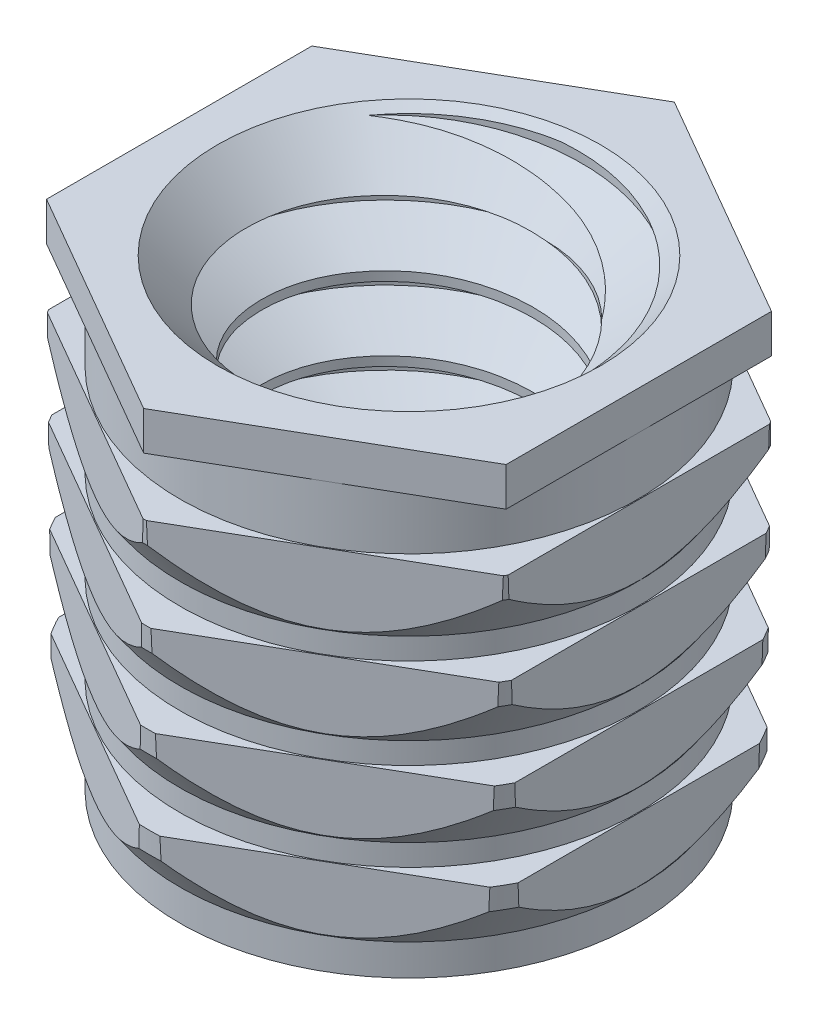
from build123d import *

# Parameters (mm, degrees)
EXTRUDE1_DEPTH   = 8.001
SKETCH4_R        = 2.350110803
EXTRUDE2_DEPTH   = 11.032485556
CHAMFER1_SIZE    = 0.9525
CUT_SWEEP1_PITCH = 1.27


with BuildPart() as part:
    # Sketch1 → Extrude1 (new body)
    with BuildSketch(Plane(origin=(0, 0, 0), x_dir=(1, 0, 0), z_dir=(0, 1, 0))):
        Polygon((0, 4.575385413), (-3.9624, 2.287692707), (-3.9624, -2.287692707), (0, -4.575385413), (3.9624, -2.287692707), (3.9624, 2.287692707), align=None)
    extrude(amount=-EXTRUDE1_DEPTH)

    # Sketch4 → Extrude2 (cut, through all)
    with BuildSketch(Plane(origin=(0, 0, 0), x_dir=(-1, 0, 0), z_dir=(0, 1, 0))):
        with Locations(Location((0, 0, 0), (0, 0, 90))):
            Circle(SKETCH4_R)
    extrude(amount=-EXTRUDE2_DEPTH, mode=Mode.SUBTRACT)

    # Chamfer1
    chamfer1_edges = [part.edges().sort_by_distance(p)[0] for p in [
        (0, -8.001, -2.350110803),
        (0, 0, -2.350110803),
    ]]
    chamfer(chamfer1_edges, length=CHAMFER1_SIZE)

    # Sketch5 → Cut-Revolve1 (revolve, cut)
    with BuildSketch(Plane.XY):
        Polygon((-3.9497, -8.001), (-4.575385413, -8.001), (-5.201070827, -8.001), (-5.201070827, 0), (-4.575385413, 0), (-4.575385413, -0.66675), (-3.9497, -0.66675), (-3.9497, -1.666875), (-4.557928166, -1.666875), (-4.551463365, -2.037243216), (-3.9497, -2.896650367), (-3.9497, -3.267075), (-4.529996572, -3.267075), (-4.52353177, -3.637443216), (-3.9497, -4.456959915), (-3.9497, -4.827384548), (-4.502761267, -4.827384548), (-4.496296466, -5.197752764), (-3.9497, -5.978373418), (-3.9497, -6.348798051), (-4.476204896, -6.348798051), (-4.469740094, -6.719166267), (-3.9497, -7.461860491), align=None)
    revolve(axis=Axis((0, 0, 0), (0, -1, 0)), mode=Mode.SUBTRACT)

    # Cut-Sweep1: the profile of Sketch3 screwed along a right-hand helix of 18.062 turns, 8 arcs to a turn; built about Z, then put on its axis
    cut_sweep1_z = Axis((0, 0, 0), (0, 0, 1))
    cut_sweep1_corners = [(3.175, 0, -0.15875), (3.175, 0, 0), (2.281370036, 0, 0.5159375), (2.281370036, 0, -0.6746875)]
    with BuildLine(mode=Mode.PRIVATE) as cut_sweep1_profile:
        Line(cut_sweep1_corners[0], cut_sweep1_corners[1])
        Line(cut_sweep1_corners[1], cut_sweep1_corners[2])
        Line(cut_sweep1_corners[2], cut_sweep1_corners[3])
        Line(cut_sweep1_corners[3], cut_sweep1_corners[0])
    cut_sweep1_cap = Face(cut_sweep1_profile.wire())
    cut_sweep1_turn_angles = [0, 22.5, 45, 67.5, 90, 112.5, 135, 157.5, 180, 202.5, 225, 247.5, 270, 292.5, 315, 337.5, 360]
    cut_sweep1_turn_weights = [1, 0.9238795325112867, 1, 0.9238795325112867, 1, 0.9238795325112867, 1, 0.9238795325112867, 1, 0.9238795325112867, 1, 0.9238795325112867, 1, 0.9238795325112867, 1, 0.9238795325112867, 1]
    cut_sweep1_turn_rails = [Edge.make_bspline([Vector(p[0], p[1], 0).rotate(cut_sweep1_z, cut_sweep1_turn_angles[k]) / cut_sweep1_turn_weights[k] + Vector(0, 0, p[2] + CUT_SWEEP1_PITCH * cut_sweep1_turn_angles[k] / 360) for k in range(17)], [0, 0, 0, 1, 1, 2, 2, 3, 3, 4, 4, 5, 5, 6, 6, 7, 7, 8, 8, 8], 2, cut_sweep1_turn_weights) for p in cut_sweep1_corners]
    cut_sweep1_turn_sides = [Face.make_surface_from_curves(cut_sweep1_turn_rails[p[0]], cut_sweep1_turn_rails[p[1]]) for p in [(0, 1), (1, 2), (2, 3), (3, 0)]]
    cut_sweep1_last_angles = [6480, 6491.16, 6502.32]
    cut_sweep1_last_weights = [1, 0.9810905174432302, 1]
    cut_sweep1_last_rails = [Edge.make_bspline([Vector(p[0], p[1], 0).rotate(cut_sweep1_z, cut_sweep1_last_angles[k]) / cut_sweep1_last_weights[k] + Vector(0, 0, p[2] + CUT_SWEEP1_PITCH * cut_sweep1_last_angles[k] / 360) for k in range(3)], [0, 0, 0, 1, 1, 1], 2, cut_sweep1_last_weights) for p in cut_sweep1_corners]
    cut_sweep1_last_sides = [Face.make_surface_from_curves(cut_sweep1_last_rails[p[0]], cut_sweep1_last_rails[p[1]]) for p in [(0, 1), (1, 2), (2, 3), (3, 0)]]
    cut_sweep1 = Plane(origin=(0, 0, 0), x_dir=(-1, 0, 0), z_dir=(0, -1, 0)) * Solid(Shell([*[p.moved(Location((0, 0, CUT_SWEEP1_PITCH * i))) for i in range(18) for p in cut_sweep1_turn_sides], *cut_sweep1_last_sides, cut_sweep1_cap, cut_sweep1_cap.rotate(cut_sweep1_z, 6502.32).moved(Location((0, 0, CUT_SWEEP1_PITCH * 6502.32 / 360)))]))
    add(cut_sweep1, mode=Mode.SUBTRACT)


solid = part.part
